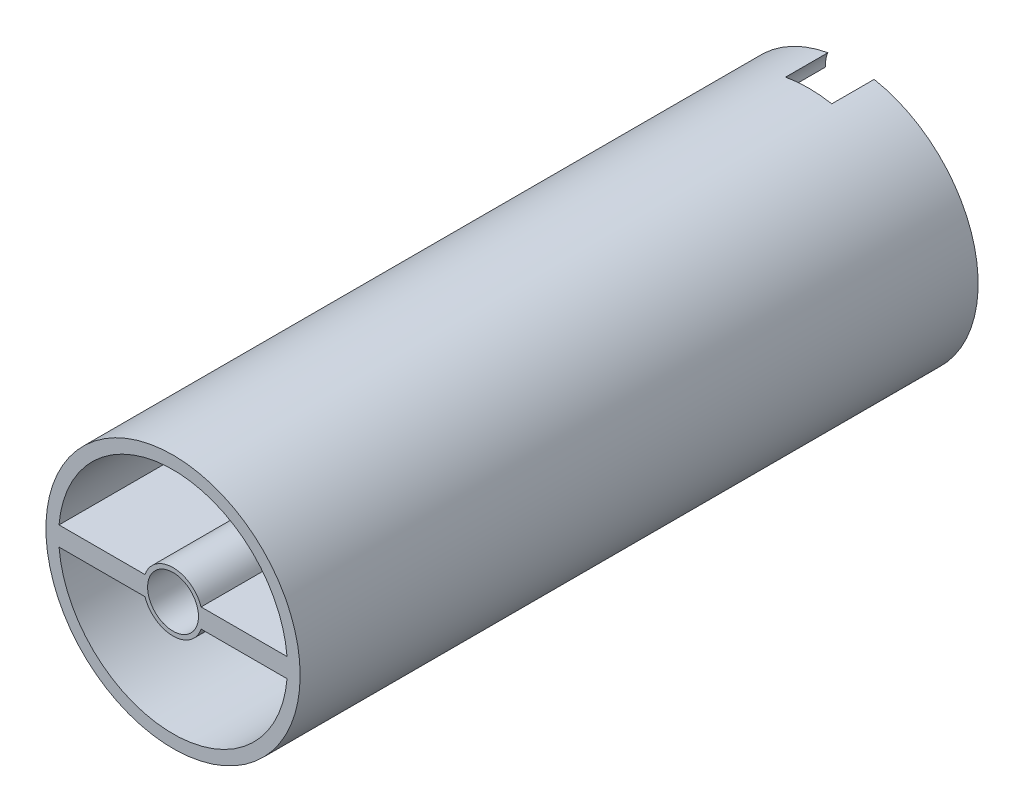
from build123d import *

# Parameters (mm, degrees)
SKETCH2_R              = 15
SKETCH2_R_2            = 13.5
SKETCH2_R_3            = 3
SHELL_DEPTH            = 80
SKETCH8_R              = 2.75
INNERPARTITION_DEPTH   = 2.5
MOVE_START             = 40
MOVE_FACE6_OUTLINE_R   = 2.75
MOVE_FACE6_DEPTH       = 2.5
MOVE_START_2           = 55
MOVE_FACE6_2_OUTLINE_R = 2.75
MOVE_FACE6_2_DEPTH     = 2.5
EASIER_ASSEMBLY_DEPTH  = 5


# Read off the part's stored shape, not the designer's step: Move Face6
with BuildPart() as part:
    # Sketch2 → Shell (new body)
    # profile 1 of 6: a face of its own
    with BuildSketch(Plane.XY):
        Circle(SKETCH2_R)
        Circle(SKETCH2_R_2, mode=Mode.SUBTRACT)
    # profile 2 of 6: a face of its own
    with BuildSketch(Plane.XY):
        with BuildLine():
            ThreePointArc((-2.727178029, 14.75), (-2.962055082, 13.975636094), (-2.98142397, 13.166666667))
            ThreePointArc((-2.98142397, 13.166666667), (0, 13.5), (2.98142397, 13.166666667))
            ThreePointArc((2.98142397, 13.166666667), (2.962055082, 13.975636094), (2.727178029, 14.75))
            ThreePointArc((2.727178029, 14.75), (0, 15), (-2.727178029, 14.75))
        make_face()
    # profile 3 of 6: a face of its own
    with BuildSketch(Plane.XY):
        with BuildLine():
            ThreePointArc((-13.452587926, -1.130432705), (-13.5, 0), (-13.452587926, 1.130432705))
            ThreePointArc((-13.452587926, 1.130432705), (-10.18513224, 8.860760761), (-2.98142397, 13.166666667))
            ThreePointArc((-2.98142397, 13.166666667), (-2.962055082, 13.975636094), (-2.727178029, 14.75))
            ThreePointArc((-2.727178029, 14.75), (-15, 0), (-2.727178029, -14.75))
            ThreePointArc((-2.727178029, -14.75), (-2.962055082, -13.975636094), (-2.98142397, -13.166666667))
            ThreePointArc((-2.98142397, -13.166666667), (-10.18513224, -8.860760761), (-13.452587926, -1.130432705))
        make_face()
    # profile 4 of 6: a face of its own
    with BuildSketch(Plane.XY):
        with BuildLine():
            ThreePointArc((2.727178029, 14.75), (2.962055082, 13.975636094), (2.98142397, 13.166666667))
            ThreePointArc((2.98142397, 13.166666667), (10.18513224, 8.860760761), (13.452587926, 1.130432705))
            ThreePointArc((13.452587926, 1.130432705), (13.488141773, 0.565713268), (13.5, 0))
            ThreePointArc((13.5, 0), (13.488141773, -0.565713268), (13.452587926, -1.130432705))
            ThreePointArc((13.452587926, -1.130432705), (10.18513224, -8.860760761), (2.98142397, -13.166666667))
            ThreePointArc((2.98142397, -13.166666667), (2.962055082, -13.975636094), (2.727178029, -14.75))
            ThreePointArc((2.727178029, -14.75), (11.530560924, -9.594069251), (15, 0))
            ThreePointArc((15, 0), (11.530560924, 9.594069251), (2.727178029, 14.75))
        make_face()
    # profile 5 of 6: a face of its own
    with BuildSketch(Plane.XY):
        with BuildLine():
            ThreePointArc((2.98142397, -13.166666667), (0, -13.5), (-2.98142397, -13.166666667))
            ThreePointArc((-2.98142397, -13.166666667), (-2.962055082, -13.975636094), (-2.727178029, -14.75))
            ThreePointArc((-2.727178029, -14.75), (0, -15), (2.727178029, -14.75))
            ThreePointArc((2.727178029, -14.75), (2.962055082, -13.975636094), (2.98142397, -13.166666667))
        make_face()
    # profile 6 of 6: a face of its own
    with BuildSketch(Plane.XY):
        with BuildLine():
            Line((-3.312419342, 1.130432705), (-13.452587926, 1.130432705))
            ThreePointArc((-13.452587926, 1.130432705), (-13.5, 0), (-13.452587926, -1.130432705))
            Line((-13.452587926, -1.130432705), (-3.312419342, -1.130432705))
            ThreePointArc((-3.312419342, -1.130432705), (0, -3.5), (3.312419342, -1.130432705))
            Line((3.312419342, -1.130432705), (13.452587926, -1.130432705))
            ThreePointArc((13.452587926, -1.130432705), (13.488141773, -0.565713268), (13.5, 0))
            ThreePointArc((13.5, 0), (13.488141773, 0.565713268), (13.452587926, 1.130432705))
            Line((13.452587926, 1.130432705), (3.312419342, 1.130432705))
            ThreePointArc((3.312419342, 1.130432705), (0, 3.5), (-3.312419342, 1.130432705))
        make_face()
        Circle(SKETCH2_R_3, mode=Mode.SUBTRACT)
    extrude(amount=SHELL_DEPTH)

    # Sketch8 → InnerPartition (add)
    # profile 1 of 2: a face of its own
    with BuildSketch(Plane.XY.offset(40)):
        with BuildLine():
            ThreePointArc((13.452587926, 1.130432705), (0, 13.5), (-13.452587926, 1.130432705))
            Line((-13.452587926, 1.130432705), (-3.312419342, 1.130432705))
            ThreePointArc((-3.312419342, 1.130432705), (0, 3.5), (3.312419342, 1.130432705))
            Line((3.312419342, 1.130432705), (13.452587926, 1.130432705))
        make_face()
        with Locations((0, 8)):
            Circle(SKETCH8_R, mode=Mode.SUBTRACT)
    # profile 2 of 2: a face of its own
    with BuildSketch(Plane.XY.offset(40)):
        with BuildLine():
            Line((-3.312419342, -1.130432705), (-13.452587926, -1.130432705))
            ThreePointArc((-13.452587926, -1.130432705), (0, -13.5), (13.452587926, -1.130432705))
            Line((13.452587926, -1.130432705), (3.312419342, -1.130432705))
            ThreePointArc((3.312419342, -1.130432705), (0, -3.5), (-3.312419342, -1.130432705))
        make_face()
        with Locations((0, -8)):
            Circle(SKETCH8_R, mode=Mode.SUBTRACT)
    extrude(amount=INNERPARTITION_DEPTH)

    # Move Face6 outline → Move Face6 (cut)
    # profile 1 of 2: a face of its own
    with BuildSketch(Plane.XY.offset(MOVE_START)):
        with BuildLine():
            ThreePointArc((-13.452587926, -1.130432705), (0, -13.5), (13.452587926, -1.130432705))
            Line((13.452587926, -1.130432705), (3.312419342, -1.130432705))
            ThreePointArc((3.312419342, -1.130432705), (0, -3.5), (-3.312419342, -1.130432705))
            Line((-3.312419342, -1.130432705), (-13.452587926, -1.130432705))
        make_face()
        with Locations((0, -8)):
            Circle(MOVE_FACE6_OUTLINE_R, mode=Mode.SUBTRACT)
    # profile 2 of 2: a face of its own
    with BuildSketch(Plane.XY.offset(MOVE_START)):
        with BuildLine():
            ThreePointArc((13.452587926, 1.130432705), (0, 13.5), (-13.452587926, 1.130432705))
            Line((-13.452587926, 1.130432705), (-3.312419342, 1.130432705))
            ThreePointArc((-3.312419342, 1.130432705), (0, 3.5), (3.312419342, 1.130432705))
            Line((3.312419342, 1.130432705), (13.452587926, 1.130432705))
        make_face()
        with Locations((0, 8)):
            Circle(MOVE_FACE6_OUTLINE_R, mode=Mode.SUBTRACT)
    extrude(amount=MOVE_FACE6_DEPTH, mode=Mode.SUBTRACT)

    # Move Face6 2 outline → Move Face6 2 (add)
    # profile 1 of 2: a face of its own
    with BuildSketch(Plane.XY.offset(MOVE_START_2)):
        with BuildLine():
            ThreePointArc((-13.452587926, -1.130432705), (0, -13.5), (13.452587926, -1.130432705))
            Line((13.452587926, -1.130432705), (3.312419342, -1.130432705))
            ThreePointArc((3.312419342, -1.130432705), (0, -3.5), (-3.312419342, -1.130432705))
            Line((-3.312419342, -1.130432705), (-13.452587926, -1.130432705))
        make_face()
        with Locations((0, -8)):
            Circle(MOVE_FACE6_2_OUTLINE_R, mode=Mode.SUBTRACT)
    # profile 2 of 2: a face of its own
    with BuildSketch(Plane.XY.offset(MOVE_START_2)):
        with BuildLine():
            ThreePointArc((13.452587926, 1.130432705), (0, 13.5), (-13.452587926, 1.130432705))
            Line((-13.452587926, 1.130432705), (-3.312419342, 1.130432705))
            ThreePointArc((-3.312419342, 1.130432705), (0, 3.5), (3.312419342, 1.130432705))
            Line((3.312419342, 1.130432705), (13.452587926, 1.130432705))
        make_face()
        with Locations((0, 8)):
            Circle(MOVE_FACE6_2_OUTLINE_R, mode=Mode.SUBTRACT)
    extrude(amount=MOVE_FACE6_2_DEPTH)

    # Sketch2<12> → Easier assembly (cut)
    with BuildSketch(Plane.XY):
        with BuildLine():
            ThreePointArc((-2.727178029, 14.75), (-2.962055082, 13.975636094), (-2.98142397, 13.166666667))
            ThreePointArc((-2.98142397, 13.166666667), (0, 13.5), (2.98142397, 13.166666667))
            ThreePointArc((2.98142397, 13.166666667), (2.962055082, 13.975636094), (2.727178029, 14.75))
            ThreePointArc((2.727178029, 14.75), (0, 15), (-2.727178029, 14.75))
        make_face()
        with BuildLine():
            ThreePointArc((2.98142397, -13.166666667), (0, -13.5), (-2.98142397, -13.166666667))
            ThreePointArc((-2.98142397, -13.166666667), (-2.962055082, -13.975636094), (-2.727178029, -14.75))
            ThreePointArc((-2.727178029, -14.75), (0, -15), (2.727178029, -14.75))
            ThreePointArc((2.727178029, -14.75), (2.962055082, -13.975636094), (2.98142397, -13.166666667))
        make_face()
    extrude(amount=EASIER_ASSEMBLY_DEPTH, mode=Mode.SUBTRACT)


solid = part.part
